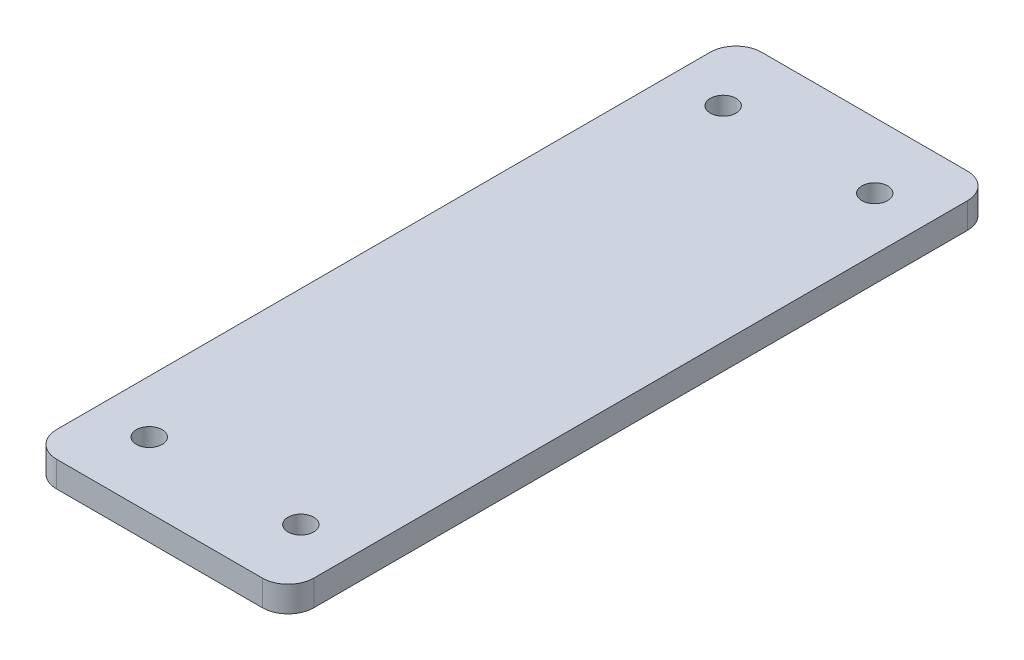
from build123d import *

# Parameters (mm, degrees)
SKETCH1_R           = 1.5
BOSS_EXTRUDE1_DEPTH = 3


with BuildPart() as part:
    # Sketch1 → Boss-Extrude1 (new body)
    with BuildSketch(Plane(origin=(0, 0, 0), x_dir=(1, 0, 0), z_dir=(0, 1, 0))):
        with BuildLine():
            Line((-12, -41.108016468), (12, -41.108016468))
            ThreePointArc((12, -41.108016468), (14.121320344, -40.229336812), (15, -38.108016468))
            Line((15, -38.108016468), (15, 38.108016468))
            ThreePointArc((15, 38.108016468), (14.121320344, 40.229336812), (12, 41.108016468))
            Line((12, 41.108016468), (-12, 41.108016468))
            ThreePointArc((-12, 41.108016468), (-14.121320344, 40.229336812), (-15, 38.108016468))
            Line((-15, 38.108016468), (-15, -38.108016468))
            ThreePointArc((-15, -38.108016468), (-14.121320344, -40.229336812), (-12, -41.108016468))
        make_face()
        with Locations((-8.838834765, 33.462792438)):
            Circle(SKETCH1_R, mode=Mode.SUBTRACT)
        with Locations((8.838834765, 33.462792438)):
            Circle(SKETCH1_R, mode=Mode.SUBTRACT)
        with Locations((8.838834765, -33.462792438)):
            Circle(SKETCH1_R, mode=Mode.SUBTRACT)
        with Locations((-8.838834765, -33.462792438)):
            Circle(SKETCH1_R, mode=Mode.SUBTRACT)
    extrude(amount=BOSS_EXTRUDE1_DEPTH)


solid = part.part
